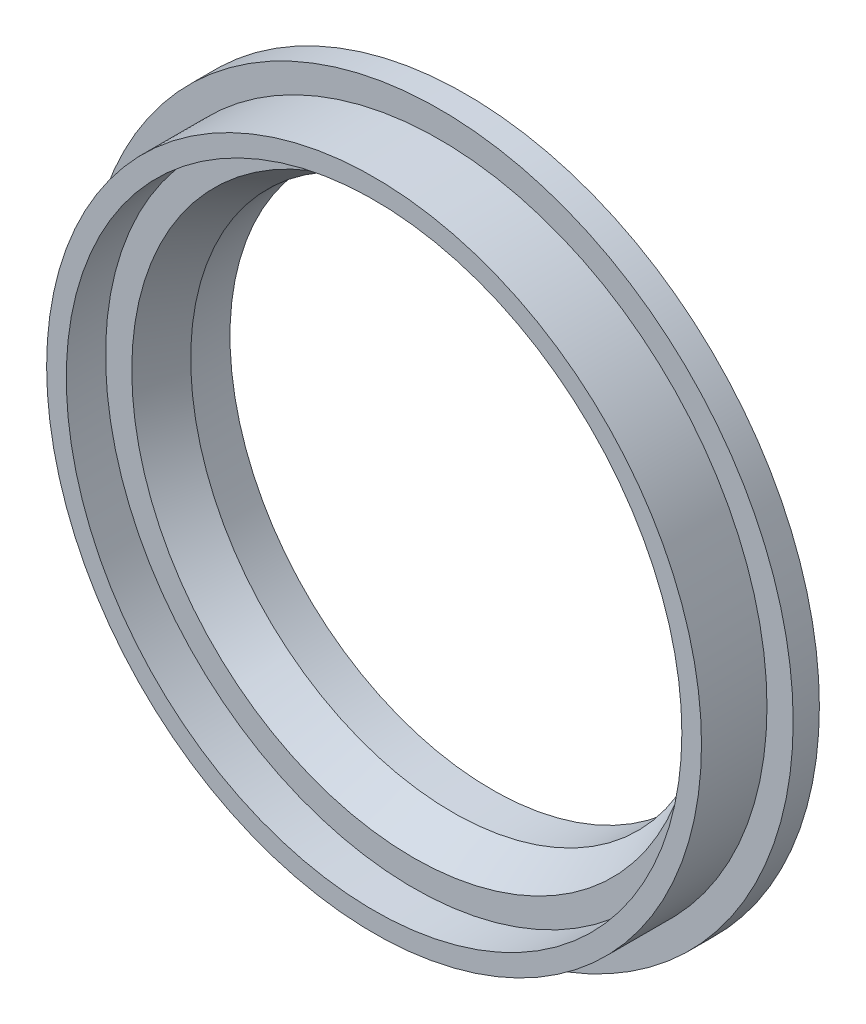
from build123d import *


with BuildPart() as part:
    # Szkic1 → Obrót1 (revolve)
    with BuildSketch(Plane(origin=(0, 0, 0), x_dir=(1, 0, 0), z_dir=(0, 1, 0))):
        Polygon((20, 9.5), (20, 6.5), (21.5, 3.5), (23.5, 3.5), (23.5, 0.5), (25, 0.5), (25, 5.5), (27, 5.5), (27, 7.5), (23, 8.5), (23, 9.5), align=None)
    revolve(axis=Axis((0, 0, 0), (0, 0, -1)))


solid = part.part
